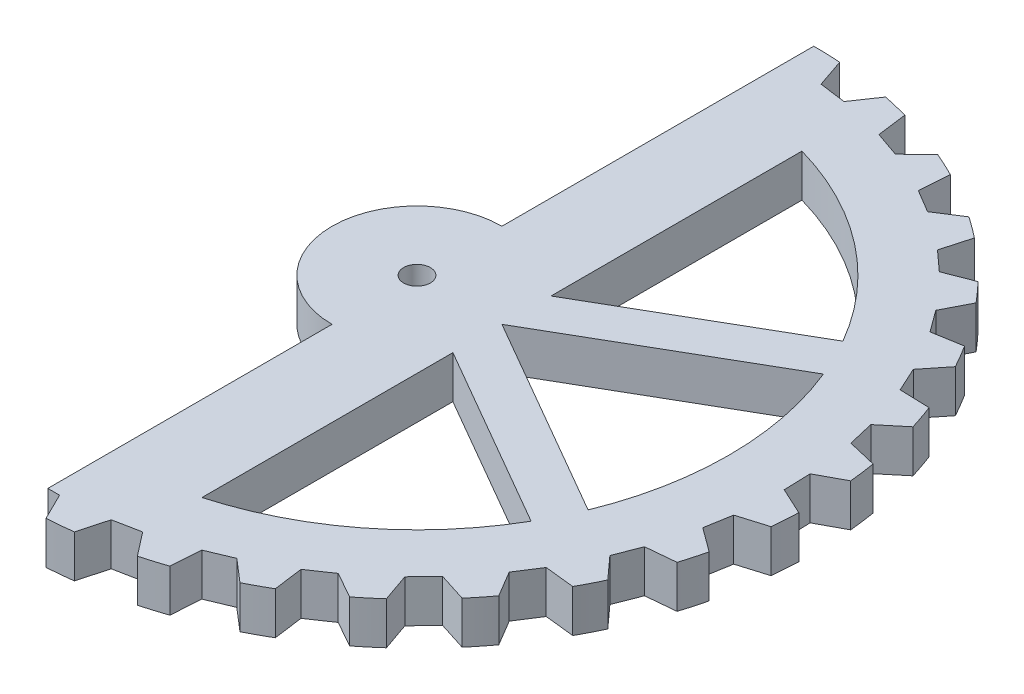
from build123d import *

# Parameters (mm, degrees)
BOSS_EXTRUDE1_DEPTH = 3.175
CUT_EXTRUDE1_DEPTH  = 3.175
CIRPATTERN1_DEPTH   = 3.175
SKETCH3_R           = 1
CUT_EXTRUDE2_DEPTH  = 3.175


# Read off the part's stored shape, not the designer's step: CirPattern1
with BuildPart() as part:
    # Sketch1 → Boss-Extrude1 (new body)
    with BuildSketch(Plane(origin=(0, 0, 0), x_dir=(1, 0, 0), z_dir=(0, 1, 0))):
        with BuildLine():
            Line((0, 29.6545), (0, 6.35))
            ThreePointArc((0, 6.35), (-6.35, 0), (0, -6.35))
            Line((0, -6.35), (0, -29.6545))
            ThreePointArc((0, -29.6545), (29.6545, 0), (0, 29.6545))
        make_face()
        with BuildLine():
            Line((6.35, 22.422694313), (6.35, 3.666174209))
            Line((6.35, 3.666174209), (20.182289022, 11.65225))
            ThreePointArc((20.182289022, 11.65225), (14.317514025, 18.387727222), (6.35, 22.422694313))
        make_face(mode=Mode.SUBTRACT)
        with BuildLine():
            Line((6.35, 0), (21.581607168, -8.793972499))
            ThreePointArc((21.581607168, -8.793972499), (23.3045, 0), (21.581607168, 8.793972499))
            Line((21.581607168, 8.793972499), (6.35, 0))
        make_face(mode=Mode.SUBTRACT)
        with BuildLine():
            Line((6.35, -3.666174209), (20.182289022, -11.65225))
            ThreePointArc((20.182289022, -11.65225), (14.317514025, -18.387727222), (6.35, -22.422694313))
            Line((6.35, -22.422694313), (6.35, -3.666174209))
        make_face(mode=Mode.SUBTRACT)
    extrude(amount=BOSS_EXTRUDE1_DEPTH)

    # Sketch2 → Cut-Extrude1 (cut)
    with BuildSketch(Plane(origin=(0, 3.175, 0), x_dir=(1, 0, 0), z_dir=(0, 1, 0))):
        Polygon((2.009170374, 29.586358422), (2.730257833, 27.469749607), (4.711979869, 27.199976048), (5.972614446, 29.046811304), align=None)
    extrude(amount=-CUT_EXTRUDE1_DEPTH, mode=Mode.SUBTRACT)


with BuildPart() as body_2:
    # of the pieces the cut leaves, the one that is kept (cut_extrude1_keep)
    add(part.part.solids().sort_by_distance((0, 0, -29.6545))[0])

    # CirPattern1 outline → CirPattern1 (cut)
    with BuildSketch(Plane(origin=(0, 0, 0), x_dir=(1, 0, 0), z_dir=(0, 1, 0))):
        with BuildLine():
            ThreePointArc((11.643715218, 27.272940182), (9.777824138, 27.996134115), (7.867406851, 28.59183939))
            Line((7.867406851, 28.59183939), (8.152034339, 26.373960405))
            Line((8.152034339, 26.373960405), (10.040188522, 25.714510801))
            Line((10.040188522, 25.714510801), (11.643715218, 27.272940182))
        make_face()
        with BuildLine():
            ThreePointArc((0, -29.6545), (0.935371957, -29.639744425), (1.869813063, -29.595492382))
            Line((1.869813063, -29.595492382), (0.878621718, -27.591112249))
            Line((0.878621718, -27.591112249), (0, -27.587246726))
            Line((0, -27.587246726), (0, -29.6545))
        make_face()
        with BuildLine():
            ThreePointArc((3.809498846, -29.408792712), (5.784253675, -29.084906389), (7.732668198, -28.628573363))
            Line((7.732668198, -28.628573363), (6.361766185, -26.862043524))
            Line((6.361766185, -26.862043524), (4.400181509, -27.252153199))
            Line((4.400181509, -27.252153199), (3.809498846, -29.408792712))
        make_face()
        with BuildLine():
            ThreePointArc((9.596192288, -28.058910596), (11.466730783, -27.347823595), (13.285052137, -26.51220021))
            Line((13.285052137, -26.51220021), (11.589481982, -25.054447882))
            Line((11.589481982, -25.054447882), (9.745052057, -25.827803075))
            Line((9.745052057, -25.827803075), (9.596192288, -28.058910596))
        make_face()
        with BuildLine():
            ThreePointArc((14.997592941, -25.582446643), (16.688811877, -24.512709528), (18.304033384, -23.331346556))
            Line((18.304033384, -23.331346556), (16.35187323, -22.240901357))
            Line((16.35187323, -22.240901357), (14.698653008, -23.3664514))
            Line((14.698653008, -23.3664514), (14.997592941, -25.582446643))
        make_face()
        with BuildLine():
            ThreePointArc((19.796831377, -22.078832344), (21.240827314, -20.693395692), (22.588096877, -19.213725556))
            Line((22.588096877, -19.213725556), (20.457727108, -18.534369503))
            Line((20.457727108, -18.534369503), (19.062094358, -19.966922897))
            Line((19.062094358, -19.966922897), (19.796831377, -22.078832344))
        make_face()
        with BuildLine():
            ThreePointArc((23.801215338, -17.688739883), (24.940010987, -16.043229793), (25.965234936, -14.324662123))
            Line((25.965234936, -14.324662123), (23.742191157, -14.083671764))
            Line((23.742191157, -14.083671764), (22.660181358, -15.765710644))
            Line((22.660181358, -15.765710644), (23.801215338, -17.688739883))
        make_face()
        with BuildLine():
            ThreePointArc((26.849966443, -12.588434067), (27.637838485, -10.748918742), (28.299853474, -8.860455044))
            Line((28.299853474, -8.860455044), (26.073392205, -9.067506284))
            Line((26.073392205, -9.067506284), (25.348448689, -10.931495795))
            Line((25.348448689, -10.931495795), (26.849966443, -12.588434067))
        make_face()
        with BuildLine():
            ThreePointArc((28.820675533, -6.982695186), (29.22599044, -5.023032253), (29.498216176, -3.04049546))
            Line((29.498216176, -3.04049546), (27.357731153, -3.68727507))
            Line((27.357731153, -3.68727507), (27.018960831, -5.658374932))
            Line((27.018960831, -5.658374932), (28.820675533, -6.982695186))
        make_face()
        with BuildLine():
            ThreePointArc((29.634217474, -1.096596968), (29.640701614, 0.904531949), (29.512208073, 2.901541813))
            Line((29.512208073, 2.901541813), (27.543641034, 1.841002417))
            Line((27.543641034, 1.841002417), (27.604645734, -0.158066973))
            Line((27.604645734, -0.158066973), (29.634217474, -1.096596968))
        make_face()
        with BuildLine():
            ThreePointArc((29.257928078, 4.833530266), (28.865321108, 6.795778658), (28.341267381, 8.727080467))
            Line((28.341267381, 8.727080467), (26.623657455, 7.295362569))
            Line((26.623657455, 7.295362569), (27.081987803, 5.348587468))
            Line((27.081987803, 5.348587468), (29.257928078, 4.833530266))
        make_face()
        with BuildLine():
            ThreePointArc((27.706915584, 10.569588405), (26.930980906, 12.41417084), (26.03240806, 14.202221686))
            Line((26.03240806, 14.202221686), (24.634718301, 12.456809604))
            Line((24.634718301, 12.456809604), (25.471972063, 10.640492963))
            Line((25.471972063, 10.640492963), (27.706915584, 10.569588405))
        make_face()
        with BuildLine():
            ThreePointArc((25.043454062, 15.881271325), (23.915345912, 17.534126729), (22.678332178, 19.107135313))
            Line((22.678332178, 19.107135313), (21.656680655, 17.118108374))
            Line((21.656680655, 17.118108374), (22.839241597, 15.50517638))
            Line((22.839241597, 15.50517638), (25.043454062, 15.881271325))
        make_face()
        with BuildLine():
            ThreePointArc((21.374483065, 20.555311819), (19.939495651, 21.950077071), (18.413707861, 23.24488617))
            Line((18.413707861, 23.24488617), (17.809114486, 21.092104981))
            Line((17.809114486, 21.092104981), (19.289502088, 19.747317805))
            Line((19.289502088, 19.747317805), (21.374483065, 20.555311819))
        make_face()
        with BuildLine():
            ThreePointArc((16.847313945, 24.4040444), (15.16306286, 25.484718851), (13.409762295, 26.449341116))
            Line((13.409762295, 26.449341116), (13.24650185, 24.219241112))
            Line((13.24650185, 24.219241112), (14.965277675, 23.196592754))
            Line((14.965277675, 23.196592754), (16.847313945, 24.4040444))
        make_face()
    extrude(amount=CIRPATTERN1_DEPTH, mode=Mode.SUBTRACT)

    # Sketch3 → Cut-Extrude2 (cut)
    with BuildSketch(Plane(origin=(0, 3.175, 0), x_dir=(1, 0, 0), z_dir=(0, 1, 0))):
        with Locations(Location((0, 0, 0), (0, 0, 270))):
            Circle(SKETCH3_R)
    extrude(amount=-CUT_EXTRUDE2_DEPTH, mode=Mode.SUBTRACT)


solid = body_2.part
